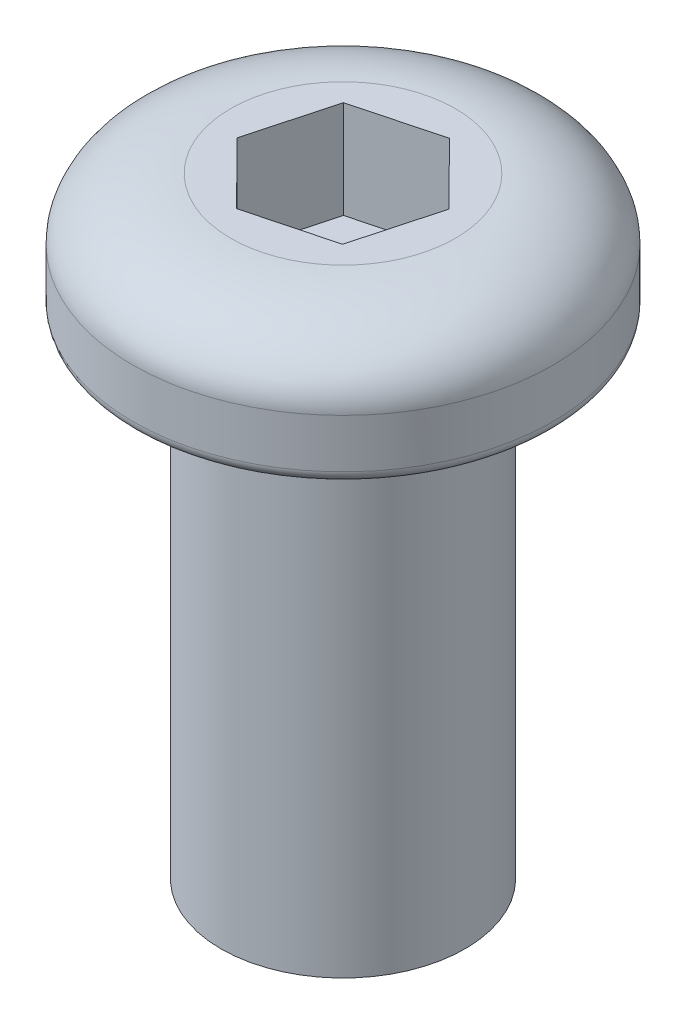
from build123d import *

# Parameters (mm, degrees)
SKETCH1_R           = 5
BOSS_EXTRUDE1_DEPTH = 20
SKETCH2_R           = 8.6
BOSS_EXTRUDE2_DEPTH = 5
FILLET1_SIZE        = 2.5
FILLET1_SIZE_2      = 4
CUT_EXTRUDE1_DEPTH  = 4
FILLET2_R           = 0.5


with BuildPart() as part:
    # Sketch1 → Boss-Extrude1 (new body)
    with BuildSketch(Plane(origin=(0, 0, 0), x_dir=(1, 0, 0), z_dir=(0, 1, 0))):
        with Locations(Location((0, 0, 0), (0, 0, 270))):
            Circle(SKETCH1_R)
    extrude(amount=BOSS_EXTRUDE1_DEPTH)

    # Sketch2 → Boss-Extrude2 (add)
    with BuildSketch(Plane(origin=(0, 20, 0), x_dir=(1, 0, 0), z_dir=(0, 1, 0))):
        with Locations(Location((0, 0, 0), (0, 0, 270))):
            Circle(SKETCH2_R)
    extrude(amount=BOSS_EXTRUDE2_DEPTH)

    # Fillet1
    # an asymmetric fillet: 4, 2.5 mm, written as the material it takes off along each edge
    with BuildSketch(Plane(origin=(0, 25, 0), x_dir=(0, 0, 1), z_dir=(-1, 0, 0))) as fillet1_piece_1:
        with BuildLine():
            Bezier((8.6, -FILLET1_SIZE), (8.6, 0), (8.6 - FILLET1_SIZE_2, 0), weights=[1, 0.707106781, 1])
            Line((8.6 - FILLET1_SIZE_2, 0), (8.6, 0))
            Line((8.6, 0), (8.6, -FILLET1_SIZE))
        make_face()
    revolve(axis=Axis((0, 25, 0), (0, 1, 0)), mode=Mode.SUBTRACT)

    # Sketch3 → Cut-Extrude1 (cut)
    with BuildSketch(Plane(origin=(0, 25, 0), x_dir=(1, 0, 0), z_dir=(0, 1, 0))):
        Polygon((2.501014418, -2.520402127), (3.433239479, 0.905740958), (0.93222506, 3.426143085), (-2.501014418, 2.520402127), (-3.433239479, -0.905740958), (-0.93222506, -3.426143085), align=None)
    extrude(amount=-CUT_EXTRUDE1_DEPTH, mode=Mode.SUBTRACT)

    # Fillet2
    fillet2_edges = [part.edges().sort_by_distance(p)[0] for p in [
        (0, 20, -8.6),
    ]]
    fillet(fillet2_edges, radius=FILLET2_R)


solid = part.part
